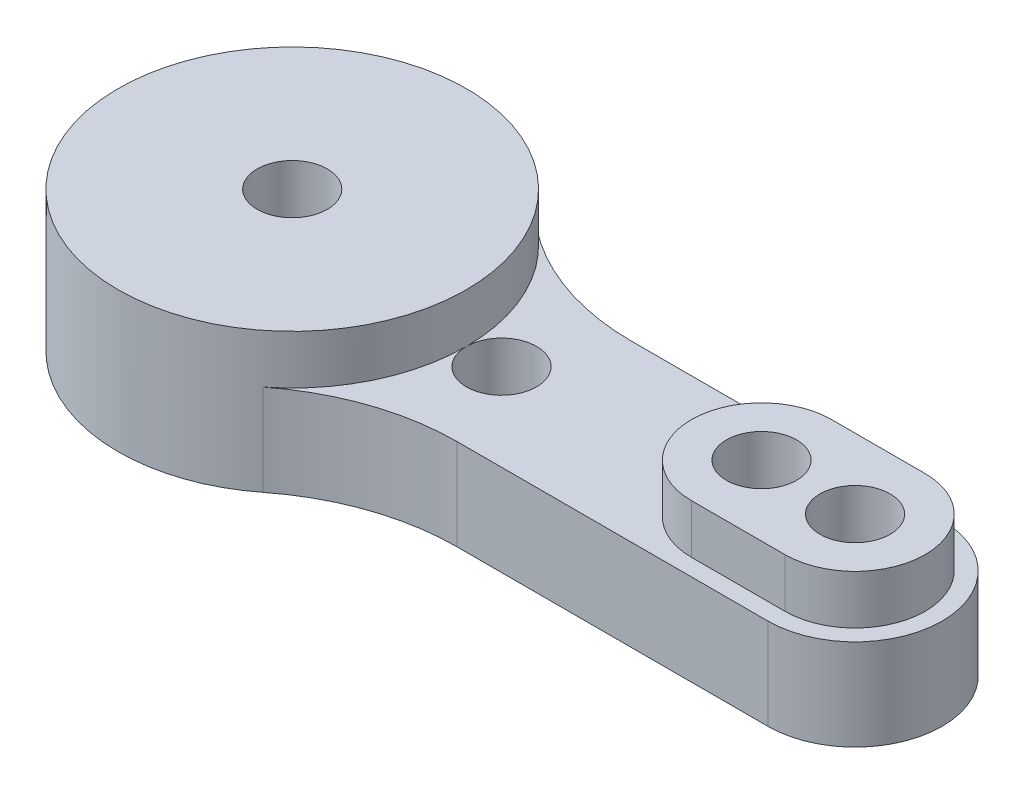
from build123d import *

# Parameters (mm, degrees)
SKETCH1_R           = 1.5
SKETCH1_R_2         = 1.5000000000000007
BOSS_EXTRUDE1_DEPTH = 3.9
BOSS_EXTRUDE2_START = 2.1
SKETCH1_3_R         = 7.449999999999999
SKETCH1_3_R_2       = 1.5
SKETCH1_3_R_3       = 1.5000000000000007
BOSS_EXTRUDE2_DEPTH = 2.1
FILLET1_R           = 10


with BuildPart() as part:
    # Sketch1 → Boss-Extrude1 (new body)
    with BuildSketch(Plane(origin=(0, 0, 0), x_dir=(1, 0, 0), z_dir=(0, 1, 0))):
        with BuildLine():
            ThreePointArc((6.451889258194068, 3.7249999999999996), (-7.45, 1.088e-14), (6.451889258194062, -3.725000000000005))
            Line((6.451889258194065, -3.725), (24.071650299632278, -3.725))
            ThreePointArc((24.071650299632278, -3.7249999999999996), (27.796650299632294, -6.66e-15), (24.071650299632292, 3.7250000000000005))
            Line((24.071650299632292, 3.725), (6.451889258194068, 3.725))
        make_face()
        Circle(SKETCH1_R, mode=Mode.SUBTRACT)
        with Locations((8.95, 3.9e-16)):
            Circle(SKETCH1_R, mode=Mode.SUBTRACT)
        with Locations((20.071650299632296, -8.8e-16)):
            Circle(SKETCH1_R_2, mode=Mode.SUBTRACT)
        with Locations((24.071650299632292, 0)):
            Circle(SKETCH1_R_2, mode=Mode.SUBTRACT)
    extrude(amount=-BOSS_EXTRUDE1_DEPTH)

    # Sketch1<3> → Boss-Extrude2 (add)
    # profile 1 of 2: a face of its own
    with BuildSketch(Plane(origin=(0, 0, 0), x_dir=(1, 0, 0), z_dir=(0, 1, 0)).offset(BOSS_EXTRUDE2_START)):
        Circle(SKETCH1_3_R)
        Circle(SKETCH1_3_R_2, mode=Mode.SUBTRACT)
    # profile 2 of 2: a face of its own
    with BuildSketch(Plane(origin=(0, 0, 0), x_dir=(1, 0, 0), z_dir=(0, 1, 0)).offset(BOSS_EXTRUDE2_START)):
        with BuildLine():
            Line((20.071650299632296, -3.0000000000000013), (24.071650299632292, -3))
            ThreePointArc((24.071650299632292, -3), (27.071650299632292, -1.8e-16), (24.071650299632292, 3))
            Line((24.071650299632292, 3), (20.071650299632296, 3.0000000000000004))
            ThreePointArc((20.071650299632296, 3), (17.071650299632296, -2.6e-16), (20.071650299632296, -3.000000000000001))
        make_face()
        with Locations((20.071650299632296, -8.8e-16)):
            Circle(SKETCH1_3_R_3, mode=Mode.SUBTRACT)
        with Locations((24.071650299632292, 0)):
            Circle(SKETCH1_3_R_3, mode=Mode.SUBTRACT)
    extrude(amount=-BOSS_EXTRUDE2_DEPTH)

    # Fillet1
    fillet1_edges = [part.edges().sort_by_distance(p)[0] for p in [
        (6.451889258194068, -1.95, -3.7249999999999996),
        (6.451889258194063, -1.95, 3.7250000000000023),
    ]]
    fillet(fillet1_edges, radius=FILLET1_R)


solid = part.part
